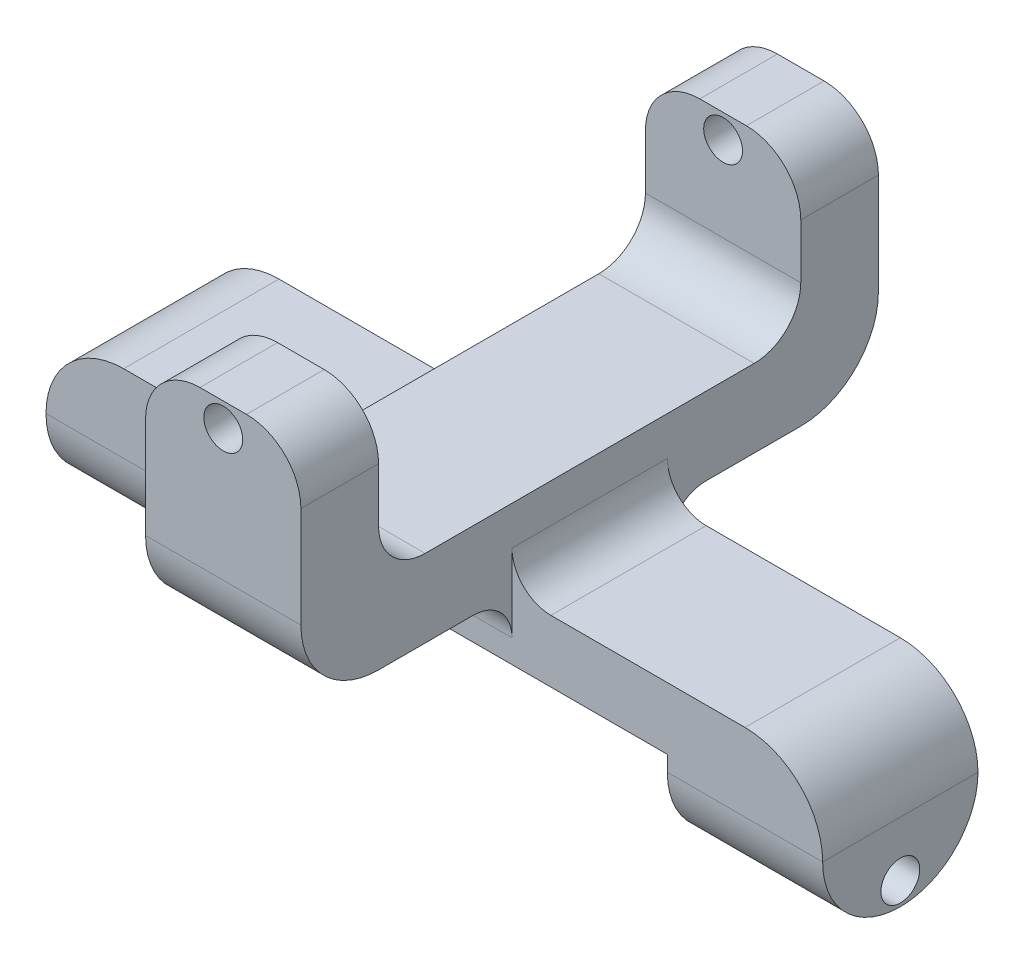
from build123d import *

# Parameters (mm, degrees)
SKETCH1_W               = 50
SKETCH1_H               = 10
BOSS_EXTRUDE1_DEPTH     = 10
SKETCH2_W               = 30
SKETCH2_H               = 10
CUT_EXTRUDE1_DEPTH      = 6
FILLET3_R               = 5
CUT_EXTRUDE2_DEPTH      = 42.533119315
CUT_EXTRUDE2_DEPTH_BACK = 42.533119315
SKETCH3_R               = 1.25
FILLET4_R               = 5
SKETCH4_W               = 10
SKETCH4_H               = 37.18
BOSS_EXTRUDE2_DEPTH     = 15
FILLET7_R               = 2.5
SKETCH5_W               = 10
SKETCH5_H               = 27.18
CUT_EXTRUDE3_DEPTH      = 10
FILLET8_R               = 2.5
CUT_EXTRUDE4_DEPTH      = 48.807451302
CUT_EXTRUDE4_DEPTH_BACK = 48.807451302
SKETCH6_R               = 1.25
FILLET9_R               = 3.5
FILLET10_R              = 5
FILLET11_R              = 3


with BuildPart() as part:
    # Sketch1 → Boss-Extrude1 (new body)
    with BuildSketch(Plane(origin=(0, 0, 0), x_dir=(1, 0, 0), z_dir=(0, 1, 0))):
        Rectangle(SKETCH1_W, SKETCH1_H)
    extrude(amount=BOSS_EXTRUDE1_DEPTH)

    # Sketch2 → Cut-Extrude1 (cut)
    with BuildSketch(Plane.XZ):
        Rectangle(SKETCH2_W, SKETCH2_H)
    extrude(amount=-CUT_EXTRUDE1_DEPTH, mode=Mode.SUBTRACT)

    # Fillet3
    fillet3_edges = [part.edges().sort_by_distance(p)[0] for p in [
        (-20, 0, -5),
        (20, 0, -5),
        (20, 0, 5),
        (-20, 0, 5),
    ]]
    fillet(fillet3_edges, radius=FILLET3_R - 0.0001)  # a hair under: the kernel refuses the full size

    # Sketch3 → Cut-Extrude2 (cut, two sides: drawn at the far end of the back side and taken through both)
    with BuildSketch(Plane(origin=(-15, 0, 0), x_dir=(0, 0, -1), z_dir=(1, 0, 0)).offset(-CUT_EXTRUDE2_DEPTH_BACK)):
        with Locations((0, 1.464466094)):
            Circle(SKETCH3_R)
    extrude(amount=CUT_EXTRUDE2_DEPTH + CUT_EXTRUDE2_DEPTH_BACK, mode=Mode.SUBTRACT)

    # Fillet4
    fillet4_edges = [part.edges().sort_by_distance(p)[0] for p in [
        (25, 10, 0),
        (-25, 10, 0),
    ]]
    fillet(fillet4_edges, radius=FILLET4_R)

    # Sketch4 → Boss-Extrude2 (add)
    with BuildSketch(Plane(origin=(0, 10, 0), x_dir=(1, 0, 0), z_dir=(0, 1, 0))):
        Rectangle(SKETCH4_W, SKETCH4_H)
    extrude(amount=BOSS_EXTRUDE2_DEPTH)

    # Fillet7
    fillet7_edges = [part.edges().sort_by_distance(p)[0] for p in [
        (0, 10, 5),
        (0, 10, -5),
    ]]
    fillet(fillet7_edges, radius=FILLET7_R)

    # Sketch5 → Cut-Extrude3 (cut)
    with BuildSketch(Plane(origin=(0, 25, 0), x_dir=(1, 0, 0), z_dir=(0, 1, 0))):
        Rectangle(SKETCH5_W, SKETCH5_H)
    extrude(amount=-CUT_EXTRUDE3_DEPTH, mode=Mode.SUBTRACT)

    # Fillet8
    fillet8_edges = [part.edges().sort_by_distance(p)[0] for p in [
        (5, 10, 0),
        (-5, 10, 0),
    ]]
    fillet(fillet8_edges, radius=FILLET8_R)

    # Sketch6 → Cut-Extrude4 (cut, two sides: drawn at the far end of the back side and taken through both)
    with BuildSketch(Plane(origin=(0, 0, 13.59), x_dir=(-1, 0, 0), z_dir=(0, 0, -1)).offset(-CUT_EXTRUDE4_DEPTH_BACK)):
        with Locations((0, 23.464881358)):
            Circle(SKETCH6_R)
    extrude(amount=CUT_EXTRUDE4_DEPTH + CUT_EXTRUDE4_DEPTH_BACK, mode=Mode.SUBTRACT)

    # Fillet9
    fillet9_edges = [part.edges().sort_by_distance(p)[0] for p in [
        (-5, 25, 16.09),
        (5, 25, -16.09),
        (-5, 25, -16.09),
        (5, 25, 16.09),
    ]]
    fillet(fillet9_edges, radius=FILLET9_R)

    # Fillet10
    fillet10_edges = [part.edges().sort_by_distance(p)[0] for p in [
        (0, 10, 18.59),
        (0, 10, -18.59),
    ]]
    fillet(fillet10_edges, radius=FILLET10_R)

    # Fillet11
    fillet11_edges = [part.edges().sort_by_distance(p)[0] for p in [
        (0, 15, 13.59),
        (0, 15, -13.59),
    ]]
    fillet(fillet11_edges, radius=FILLET11_R)


solid = part.part
